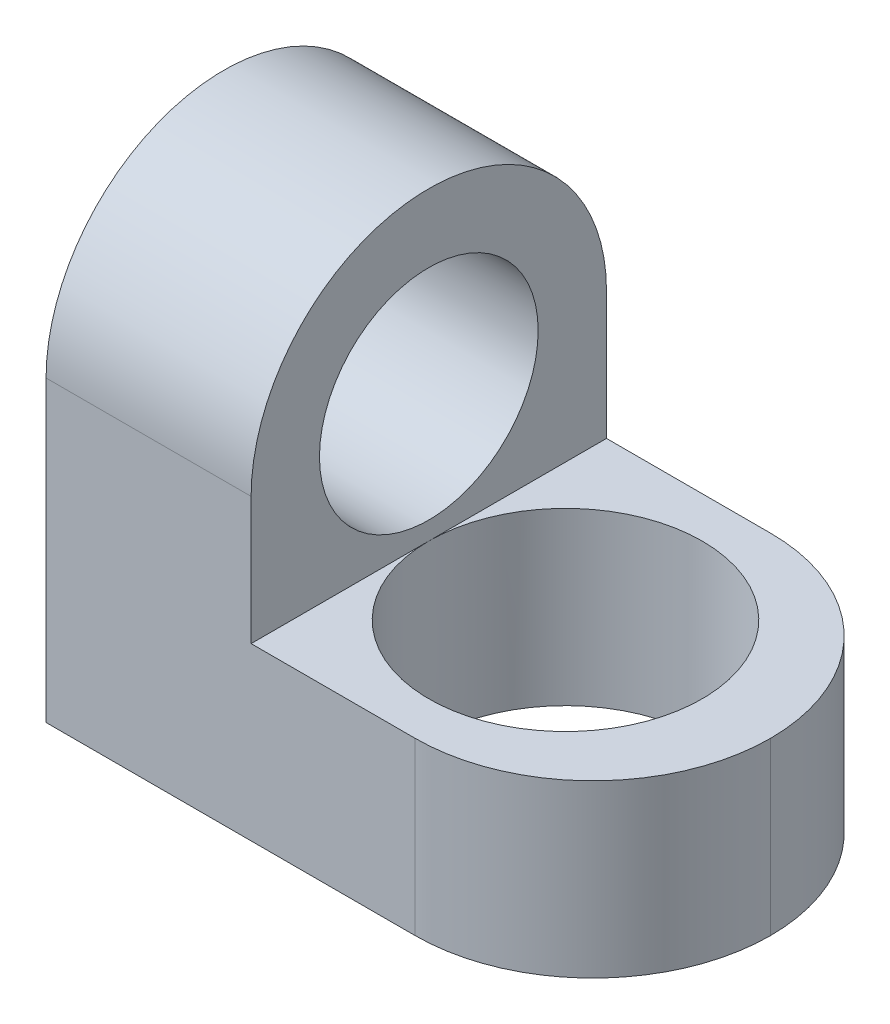
from build123d import *

# Parameters (mm, degrees)
SKETCH1_R           = 1.6
BOSS_EXTRUDE1_DEPTH = 3
SKETCH2_W           = 5.2
SKETCH2_H           = 2.5
BOSS_EXTRUDE2_DEPTH = 5
FILLET1_R           = 2.6
SKETCH3_R           = 2
CUT_EXTRUDE1_DEPTH  = 5


with BuildPart() as part:
    # Sketch1 → Boss-Extrude1 (new body)
    with BuildSketch(Plane(origin=(0, 0, 0), x_dir=(0, 0, -1), z_dir=(1, 0, 0))):
        with BuildLine():
            ThreePointArc((2.6, 0), (0, 2.6), (-2.6, 0))
            Line((-2.6, 0), (-2.6, -4.365701483))
            Line((-2.6, -4.365701483), (2.6, -4.365701483))
            Line((2.6, -4.365701483), (2.6, 0))
        make_face()
        Circle(SKETCH1_R, mode=Mode.SUBTRACT)
    extrude(amount=BOSS_EXTRUDE1_DEPTH)

    # Sketch2 → Boss-Extrude2 (add)
    with BuildSketch(Plane(origin=(3, 0, 0), x_dir=(0, 0, -1), z_dir=(1, 0, 0))):
        with Locations((0, -3.115701483)):
            Rectangle(SKETCH2_W, SKETCH2_H)
    extrude(amount=BOSS_EXTRUDE2_DEPTH)

    # Fillet1
    fillet1_edges = [part.edges().sort_by_distance(p)[0] for p in [
        (8, -3.115701483, -2.6),
        (8, -3.115701483, 2.6),
    ]]
    fillet(fillet1_edges, radius=FILLET1_R - 0.0001)  # a hair under: the kernel refuses the full size

    # Sketch3 → Cut-Extrude1 (cut)
    with BuildSketch(Plane.XZ.offset(4.365701483)):
        with Locations(Location((5, 0, 0), (0, 0, 270))):
            Circle(SKETCH3_R)
    extrude(amount=-CUT_EXTRUDE1_DEPTH, mode=Mode.SUBTRACT)


solid = part.part
